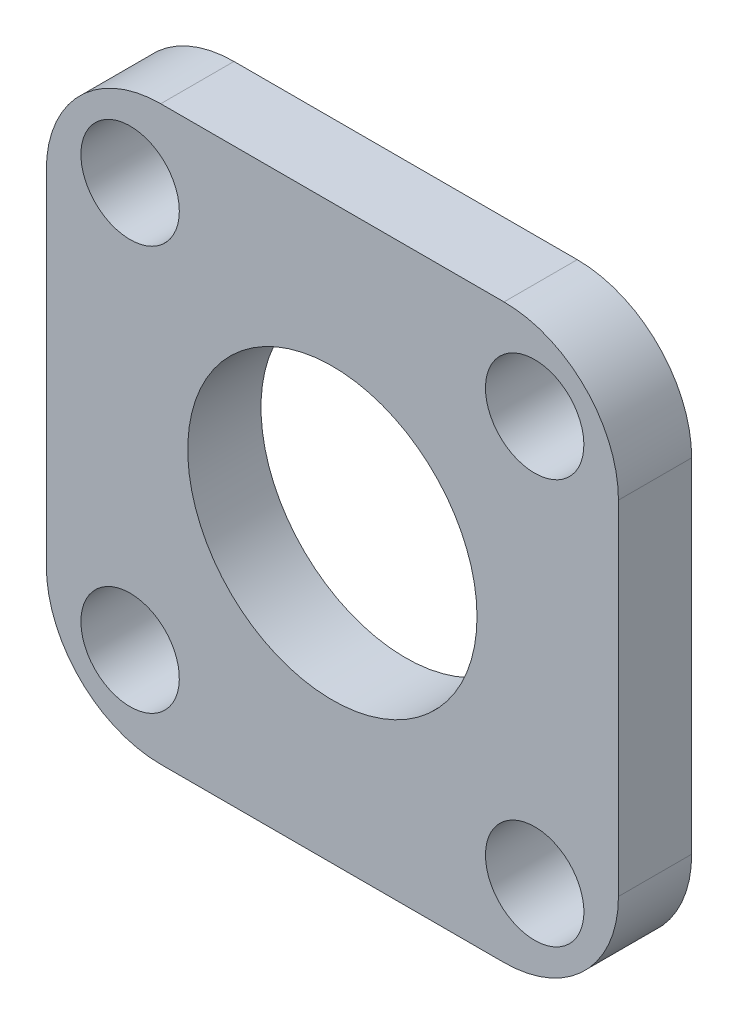
from build123d import *

# Parameters (mm, degrees)
SKETCH1_W           = 25
SKETCH1_H           = 25
BOSS_EXTRUDE1_DEPTH = 3.2
CUT_EXTRUDE1_REACH  = 19.965
SKETCH2_R           = 6.32
SKETCH3_R           = 2.15
CUT_EXTRUDE2_DEPTH  = 18.964965906
CIRPATTERN1_COUNT   = 4
FILLET2_R           = 5


with BuildPart() as part:
    # Sketch1 → Boss-Extrude1 (new body)
    with BuildSketch(Plane.XY):
        Rectangle(SKETCH1_W, SKETCH1_H)
    extrude(amount=BOSS_EXTRUDE1_DEPTH)

    # Sketch2 → Cut-Extrude1 (cut, up to next)
    with BuildSketch(Plane.XY.offset(3.2), mode=Mode.PRIVATE) as cut_extrude1_sk1:
        Circle(SKETCH2_R)
    cut_extrude1_tool1 = extrude(cut_extrude1_sk1.sketch, amount=-CUT_EXTRUDE1_REACH, mode=Mode.PRIVATE) & part.part
    add(cut_extrude1_tool1.solids().sort_by_distance((0, 0, 3.2))[0], mode=Mode.SUBTRACT)

    # Sketch3 → Cut-Extrude2 (cut, through all)
    with BuildSketch(Plane.XY.offset(3.2)):
        with Locations((-8.838834765, 8.838834765)):
            Circle(SKETCH3_R)
    cut_extrude2 = extrude(amount=-CUT_EXTRUDE2_DEPTH, mode=Mode.SUBTRACT)

    # CirPattern1: Cut-Extrude2 ×4 about axis
    cirpattern1_axis = Axis((0, 0, 3.2), (0, 0, 1))
    for i in range(1, CIRPATTERN1_COUNT):
        add(cut_extrude2.rotate(cirpattern1_axis, i * 360 / CIRPATTERN1_COUNT), mode=Mode.SUBTRACT)

    # Fillet2
    fillet2_edges = [part.edges().sort_by_distance(p)[0] for p in [
        (-12.5, -12.5, 1.6),
        (12.5, -12.5, 1.6),
        (12.5, 12.5, 1.6),
        (-12.5, 12.5, 1.6),
    ]]
    fillet(fillet2_edges, radius=FILLET2_R)


solid = part.part
